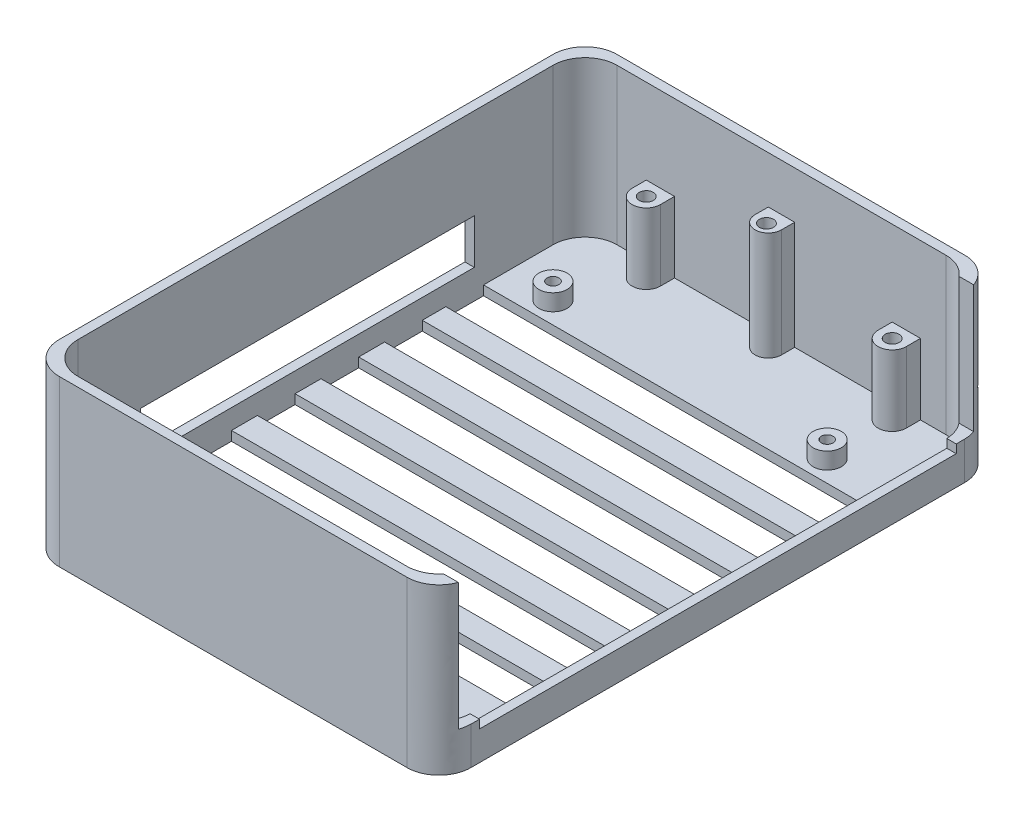
from build123d import *

# Parameters (mm, degrees)
SKETCH1_W               = 87.4
SKETCH1_H               = 118.4
BOSS_EXTRUDE1_DEPTH     = 35
SKETCH2_W               = 83.4
SKETCH2_H               = 114.4
CUT_EXTRUDE1_DEPTH      = 33
CUT_EXTRUDE2_DEPTH      = 112.213308556
CUT_EXTRUDE2_DEPTH_BACK = 33
FILLET1_R               = 6.8
SKETCH4_R               = 3
SKETCH4_R_2             = 1.25
BOSS_EXTRUDE2_DEPTH     = 3.5
SKETCH5_R               = 1.5
BOSS_EXTRUDE4_DEPTH     = 15
CUT_EXTRUDE3_START      = -20
SKETCH7_R               = 1.5
CUT_EXTRUDE3_DEPTH      = 20
SKETCH9_W               = 5.6
SKETCH9_H               = 2.8
BOSS_EXTRUDE5_DEPTH     = 23
BOSS_EXTRUDE6_DEPTH     = 23
SKETCH11_R              = 1.5
CUT_EXTRUDE4_DEPTH      = 17
SKETCH12_W              = 83.4
SKETCH12_H              = 8
CUT_EXTRUDE5_DEPTH      = 10
CUT_EXTRUDE6_START      = -10
SKETCH15_R              = 1.25
CUT_EXTRUDE6_DEPTH      = 10
SKETCH16_W              = 70.9
SKETCH16_H              = 9.5
CUT_EXTRUDE7_DEPTH      = 10


with BuildPart() as part:
    # Sketch1 → Boss-Extrude1 (new body)
    with BuildSketch(Plane(origin=(0, 0, 0), x_dir=(1, 0, 0), z_dir=(0, 1, 0))):
        Rectangle(SKETCH1_W, SKETCH1_H)
    extrude(amount=BOSS_EXTRUDE1_DEPTH)

    # Sketch2 → Cut-Extrude1 (cut)
    with BuildSketch(Plane(origin=(0, 35, 0), x_dir=(1, 0, 0), z_dir=(0, 1, 0))):
        Rectangle(SKETCH2_W, SKETCH2_H)
    extrude(amount=-CUT_EXTRUDE1_DEPTH, mode=Mode.SUBTRACT)

    # Sketch3 → Cut-Extrude2 (cut, two sides: drawn at the far end of the back side and taken through both)
    with BuildSketch(Plane(origin=(43.7, 0, 0), x_dir=(0, 0, -1), z_dir=(1, 0, 0)).offset(-CUT_EXTRUDE2_DEPTH_BACK)):
        Polygon((54.7, 283.312483937), (54.7, 35), (54.7, 8), (50.6, 8), (50.6, 6.2), (-50.6, 6.2), (-50.6, 8), (-54.7, 8), (-54.7, 35), (-54.7, 283.312483937), (-54.7, 779.93745181), (54.7, 779.93745181), align=None)
    extrude(amount=CUT_EXTRUDE2_DEPTH + CUT_EXTRUDE2_DEPTH_BACK, mode=Mode.SUBTRACT)

    # Fillet1
    fillet1_edges = [part.edges().sort_by_distance(p)[0] for p in [
        (41.7, 18.5, 57.2),
        (-41.7, 18.5, -57.2),
        (-41.7, 18.5, 57.2),
        (41.7, 18.5, -57.2),
    ]]
    fillet(fillet1_edges, radius=FILLET1_R)
    fillet1_2_edges = [part.edges().sort_by_distance(p)[0] for p in [
        (-43.7, 17.5, -59.2),
        (43.7, 17.5, -59.2),
        (43.7, 17.5, 59.2),
        (-43.7, 17.5, 59.2),
    ]]
    fillet(fillet1_2_edges, radius=FILLET1_R)

    # Sketch4 → Boss-Extrude2 (add)
    # profile 1 of 4: a face of its own
    with BuildSketch(Plane(origin=(0, 2, 0), x_dir=(1, 0, 0), z_dir=(0, 1, 0))):
        with Locations((-31.5, -45.9)):
            Circle(SKETCH4_R)
        with Locations((-31.5, -45.9)):
            Circle(SKETCH4_R_2, mode=Mode.SUBTRACT)
    # profile 2 of 4: a face of its own
    with BuildSketch(Plane(origin=(0, 2, 0), x_dir=(1, 0, 0), z_dir=(0, 1, 0))):
        with Locations((26.7, -45.9)):
            Circle(SKETCH4_R)
        with Locations((26.7, -45.9)):
            Circle(SKETCH4_R_2, mode=Mode.SUBTRACT)
    # profile 3 of 4: a face of its own
    with BuildSketch(Plane(origin=(0, 2, 0), x_dir=(1, 0, 0), z_dir=(0, 1, 0))):
        with Locations((26.7, 40.2)):
            Circle(SKETCH4_R)
        with Locations((26.7, 40.2)):
            Circle(SKETCH4_R_2, mode=Mode.SUBTRACT)
    # profile 4 of 4: a face of its own
    with BuildSketch(Plane(origin=(0, 2, 0), x_dir=(1, 0, 0), z_dir=(0, 1, 0))):
        with Locations((-31.5, 40.2)):
            Circle(SKETCH4_R)
        with Locations((-31.5, 40.2)):
            Circle(SKETCH4_R_2, mode=Mode.SUBTRACT)
    extrude(amount=BOSS_EXTRUDE2_DEPTH)

    # Sketch5 → Boss-Extrude4 (add)
    # profile 1 of 4: a face of its own
    with BuildSketch(Plane(origin=(0, 2, 0), x_dir=(1, 0, 0), z_dir=(0, 1, 0))):
        with BuildLine():
            Line((-28.7, 54.2), (-28.7, 57.2))
            Line((-28.7, 57.2), (-22.7, 57.2))
            Line((-22.7, 57.2), (-22.7, 54.2))
            ThreePointArc((-22.7, 54.2), (-25.7, 51.2), (-28.7, 54.2))
        make_face()
        with Locations((-25.7, 54.2)):
            Circle(SKETCH5_R, mode=Mode.SUBTRACT)
    # profile 2 of 4: a face of its own
    with BuildSketch(Plane(origin=(0, 2, 0), x_dir=(1, 0, 0), z_dir=(0, 1, 0))):
        with BuildLine():
            Line((23.5, 54.2), (23.5, 57.2))
            Line((23.5, 57.2), (29.5, 57.2))
            Line((29.5, 57.2), (29.5, 54.2))
            ThreePointArc((29.5, 54.2), (26.5, 51.2), (23.5, 54.2))
        make_face()
        with Locations((26.5, 54.2)):
            Circle(SKETCH5_R, mode=Mode.SUBTRACT)
    # profile 3 of 4: a face of its own
    with BuildSketch(Plane(origin=(0, 2, 0), x_dir=(1, 0, 0), z_dir=(0, 1, 0))):
        with BuildLine():
            Line((-28.7, -54), (-28.7, -57.2))
            Line((-28.7, -57.2), (-22.7, -57.2))
            Line((-22.7, -57.2), (-22.7, -54))
            ThreePointArc((-22.7, -54), (-25.7, -51), (-28.7, -54))
        make_face()
        with Locations((-25.7, -54)):
            Circle(SKETCH5_R, mode=Mode.SUBTRACT)
    # profile 4 of 4: a face of its own
    with BuildSketch(Plane(origin=(0, 2, 0), x_dir=(1, 0, 0), z_dir=(0, 1, 0))):
        with BuildLine():
            Line((23.3, -54), (23.3, -57.2))
            Line((23.3, -57.2), (29.3, -57.2))
            Line((29.3, -57.2), (29.3, -54))
            ThreePointArc((29.3, -54), (26.3, -51), (23.3, -54))
        make_face()
        with Locations((26.3, -54)):
            Circle(SKETCH5_R, mode=Mode.SUBTRACT)
    extrude(amount=BOSS_EXTRUDE4_DEPTH)

    # Sketch7 → Cut-Extrude3 (cut)
    with BuildSketch(Plane(origin=(0, 2, 0), x_dir=(1, 0, 0), z_dir=(0, 1, 0)).offset(CUT_EXTRUDE3_START)):
        with Locations((-25.7, 54.2)):
            Circle(SKETCH7_R)
        with Locations((26.5, 54.2)):
            Circle(SKETCH7_R)
        with Locations((-25.7, -54)):
            Circle(SKETCH7_R)
        with Locations((26.3, -54)):
            Circle(SKETCH7_R)
    extrude(amount=CUT_EXTRUDE3_DEPTH, mode=Mode.SUBTRACT)

    # Sketch9 → Boss-Extrude5 (add)
    with BuildSketch(Plane(origin=(0, 2, 0), x_dir=(1, 0, 0), z_dir=(0, 1, 0))):
        Polygon((0, 57.2), (-2.8, 57.2), (-2.8, 54.4), (2.8, 54.4), (2.8, 57.2), align=None)
        with Locations((-0.2, -55.8)):
            Rectangle(SKETCH9_W, SKETCH9_H)
    extrude(amount=BOSS_EXTRUDE5_DEPTH)

    # Sketch10 → Boss-Extrude6 (add)
    with BuildSketch(Plane(origin=(0, 2, 0), x_dir=(1, 0, 0), z_dir=(0, 1, 0))):
        with BuildLine():
            Line((-3, -54.4), (2.6, -54.4))
            ThreePointArc((2.6, -54.4), (-0.2, -51.6), (-3, -54.4))
        make_face()
        with BuildLine():
            Line((-2.8, 54.4), (2.8, 54.4))
            ThreePointArc((2.8, 54.4), (0, 51.6), (-2.8, 54.4))
        make_face()
    extrude(amount=BOSS_EXTRUDE6_DEPTH)

    # Sketch11 → Cut-Extrude4 (cut)
    with BuildSketch(Plane(origin=(0, 25, 0), x_dir=(1, 0, 0), z_dir=(0, 1, 0))):
        with Locations((0, 54.004388867)):
            Circle(SKETCH11_R)
        with Locations((0, -54.2)):
            Circle(SKETCH11_R)
    extrude(amount=-CUT_EXTRUDE4_DEPTH, mode=Mode.SUBTRACT)

    # Sketch12 → Cut-Extrude5 (cut)
    with BuildSketch(Plane(origin=(0, 2, 0), x_dir=(1, 0, 0), z_dir=(0, 1, 0))):
        with Locations((0, -34.845738234)):
            Rectangle(SKETCH12_W, SKETCH12_H)
        with Locations((0, -21.845738234)):
            Rectangle(SKETCH12_W, SKETCH12_H)
        with Locations((0, -8.345738234)):
            Rectangle(SKETCH12_W, SKETCH12_H)
        with Locations((0, 5.154261766)):
            Rectangle(SKETCH12_W, SKETCH12_H)
        with Locations((0, 18.654261766)):
            Rectangle(SKETCH12_W, SKETCH12_H)
        with Locations((0, 31.654261766)):
            Rectangle(SKETCH12_W, SKETCH12_H)
    extrude(amount=-CUT_EXTRUDE5_DEPTH, mode=Mode.SUBTRACT)

    # Sketch15 → Cut-Extrude6 (cut)
    with BuildSketch(Plane(origin=(0, 5.5, 0), x_dir=(1, 0, 0), z_dir=(0, 1, 0)).offset(CUT_EXTRUDE6_START)):
        with Locations((26.7, -45.9)):
            Circle(SKETCH15_R)
        with Locations((-31.5, -45.9)):
            Circle(SKETCH15_R)
        with Locations((26.7, 40.2)):
            Circle(SKETCH15_R)
        with Locations((-31.5, 40.2)):
            Circle(SKETCH15_R)
    extrude(amount=CUT_EXTRUDE6_DEPTH, mode=Mode.SUBTRACT)

    # Sketch16 → Cut-Extrude7 (cut)
    with BuildSketch(Plane.ZY.offset(43.7)):
        with Locations((1.75, 10.95)):
            Rectangle(SKETCH16_W, SKETCH16_H)
    extrude(amount=-CUT_EXTRUDE7_DEPTH, mode=Mode.SUBTRACT)


solid = part.part
